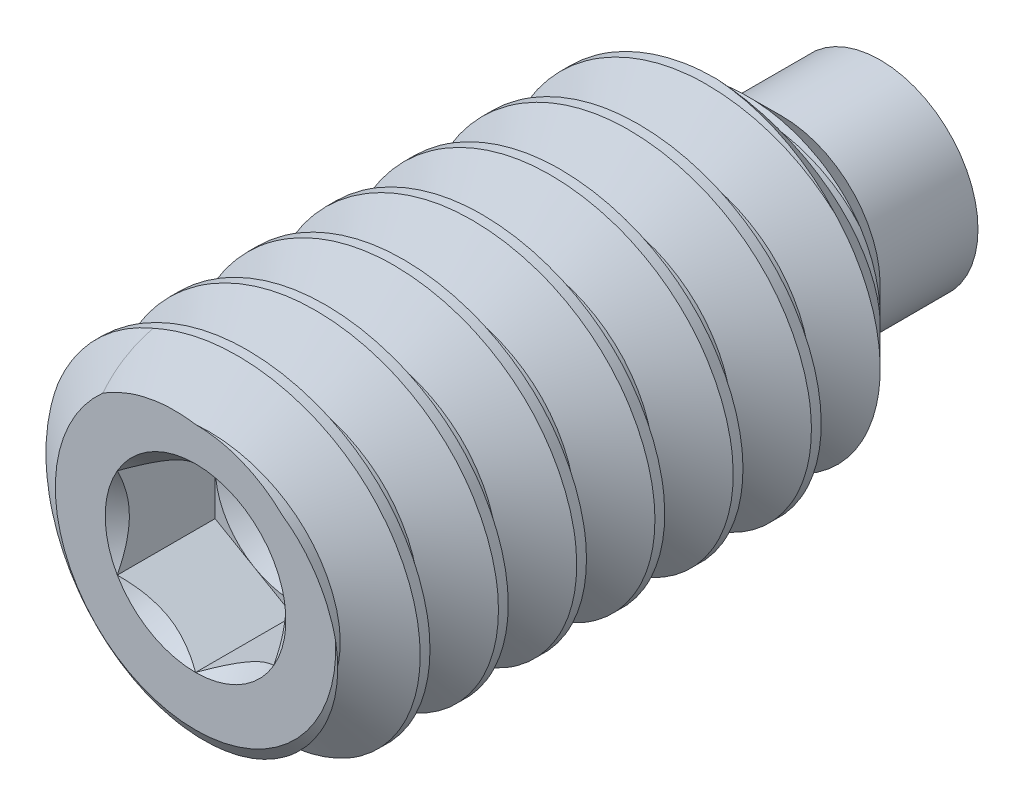
from build123d import *

# Parameters (mm, degrees)
CUT_SWEEP2_PITCH    = 0.635
CUT_EXTRUDE10_DEPTH = 0.79375


with BuildPart() as part:
    # Sketch22 → Revolve1 (revolve)
    with BuildSketch(Plane(origin=(0, 0, 0), x_dir=(0, 0, -1), z_dir=(1, 0, 0)), mode=Mode.PRIVATE) as revolve1_sk:
        Polygon((-2.778125, 0), (-2.778125, 1.13792), (-2.57892996, 1.4224), (1.355725, 1.4224), (1.984375, 0.79375), (2.778125, 0.79375), (2.778125, 0), align=None)
    revolve(revolve1_sk.sketch.rotate(Axis((0, 0, -2.778125), (0, 0, 1)), 90), axis=Axis((0, 0, -2.778125), (0, 0, 1)))

    # Cut-Sweep2: the profile of Sketch28 profile screwed along a right-hand helix of 9.5 turns, 6 arcs to a turn; built about Z, then put on its axis
    cut_sweep2_z = Axis((0, 0, 0), (0, 0, 1))
    cut_sweep2_corners = [(1.4227, 0, 0.000173205), (1.4227, 0, -0.555798205), (1.009955401, 0, -0.3175), (1.009955401, 0, -0.238125)]
    with BuildLine(mode=Mode.PRIVATE) as cut_sweep2_profile:
        Line(cut_sweep2_corners[0], cut_sweep2_corners[1])
        Line(cut_sweep2_corners[1], cut_sweep2_corners[2])
        Line(cut_sweep2_corners[2], cut_sweep2_corners[3])
        Line(cut_sweep2_corners[3], cut_sweep2_corners[0])
    cut_sweep2_cap = Face(cut_sweep2_profile.wire())
    cut_sweep2_turn_angles = [0, 30, 60, 90, 120, 150, 180, 210, 240, 270, 300, 330, 360]
    cut_sweep2_turn_weights = [1, 0.8660254037844387, 1, 0.8660254037844387, 1, 0.8660254037844387, 1, 0.8660254037844387, 1, 0.8660254037844387, 1, 0.8660254037844387, 1]
    cut_sweep2_turn_rails = [Edge.make_bspline([Vector(p[0], p[1], 0).rotate(cut_sweep2_z, cut_sweep2_turn_angles[k]) / cut_sweep2_turn_weights[k] + Vector(0, 0, p[2] + CUT_SWEEP2_PITCH * cut_sweep2_turn_angles[k] / 360) for k in range(13)], [0, 0, 0, 1, 1, 2, 2, 3, 3, 4, 4, 5, 5, 6, 6, 6], 2, cut_sweep2_turn_weights) for p in cut_sweep2_corners]
    cut_sweep2_turn_sides = [Face.make_surface_from_curves(cut_sweep2_turn_rails[p[0]], cut_sweep2_turn_rails[p[1]]) for p in [(0, 1), (1, 2), (2, 3), (3, 0)]]
    cut_sweep2_last_angles = [3240, 3270, 3300, 3330, 3360, 3390, 3420]
    cut_sweep2_last_weights = [1, 0.8660254037844387, 1, 0.8660254037844387, 1, 0.866025403784401, 1]
    cut_sweep2_last_rails = [Edge.make_bspline([Vector(p[0], p[1], 0).rotate(cut_sweep2_z, cut_sweep2_last_angles[k]) / cut_sweep2_last_weights[k] + Vector(0, 0, p[2] + CUT_SWEEP2_PITCH * cut_sweep2_last_angles[k] / 360) for k in range(7)], [0, 0, 0, 1, 1, 2, 2, 3, 3, 3], 2, cut_sweep2_last_weights) for p in cut_sweep2_corners]
    cut_sweep2_last_sides = [Face.make_surface_from_curves(cut_sweep2_last_rails[p[0]], cut_sweep2_last_rails[p[1]]) for p in [(0, 1), (1, 2), (2, 3), (3, 0)]]
    cut_sweep2 = Plane(origin=(0, 0, -1.984375), x_dir=(0, 1, 0), z_dir=(0, 0, 1)) * Solid(Shell([*[p.moved(Location((0, 0, CUT_SWEEP2_PITCH * i))) for i in range(9) for p in cut_sweep2_turn_sides], *cut_sweep2_last_sides, cut_sweep2_cap, cut_sweep2_cap.rotate(cut_sweep2_z, 3420).moved(Location((0, 0, CUT_SWEEP2_PITCH * 3420 / 360)))]))
    add(cut_sweep2, mode=Mode.SUBTRACT)

    # Sketch23 → Cut-Extrude10 (cut)
    with BuildSketch(Plane.XY.offset(2.778125)):
        Polygon((0, 0.733234842), (-0.635, 0.366617421), (-0.635, -0.366617421), (0, -0.733234842), (0.635, -0.366617421), (0.635, 0.366617421), align=None)
    extrude(amount=-CUT_EXTRUDE10_DEPTH, mode=Mode.SUBTRACT)

    # Cut-Extrude11 cone 1 section (through the dimple's axis) → Cut-Extrude11 (revolve, cut)
    with BuildSketch(Plane(origin=(0, 0, 2.778125), x_dir=(0, -1, 0), z_dir=(1, 0, 0))):
        Polygon((0, 0), (0.733234842, 0), (0, 0.733234842), align=None)
    revolve(axis=Axis((0, 0, 2.778125), (0, 0, -1)), mode=Mode.SUBTRACT)

    # Cut-Extrude12 cone 1 section (through the dimple's axis) → Cut-Extrude12 (revolve, cut)
    with BuildSketch(Plane(origin=(0, 0, 1.984375), x_dir=(0, -1, 0), z_dir=(1, 0, 0))):
        Polygon((0, 0), (0.635, 0), (0, 0.366617421), align=None)
    revolve(axis=Axis((0, 0, 1.984375), (0, 0, -1)), mode=Mode.SUBTRACT)


solid = part.part
